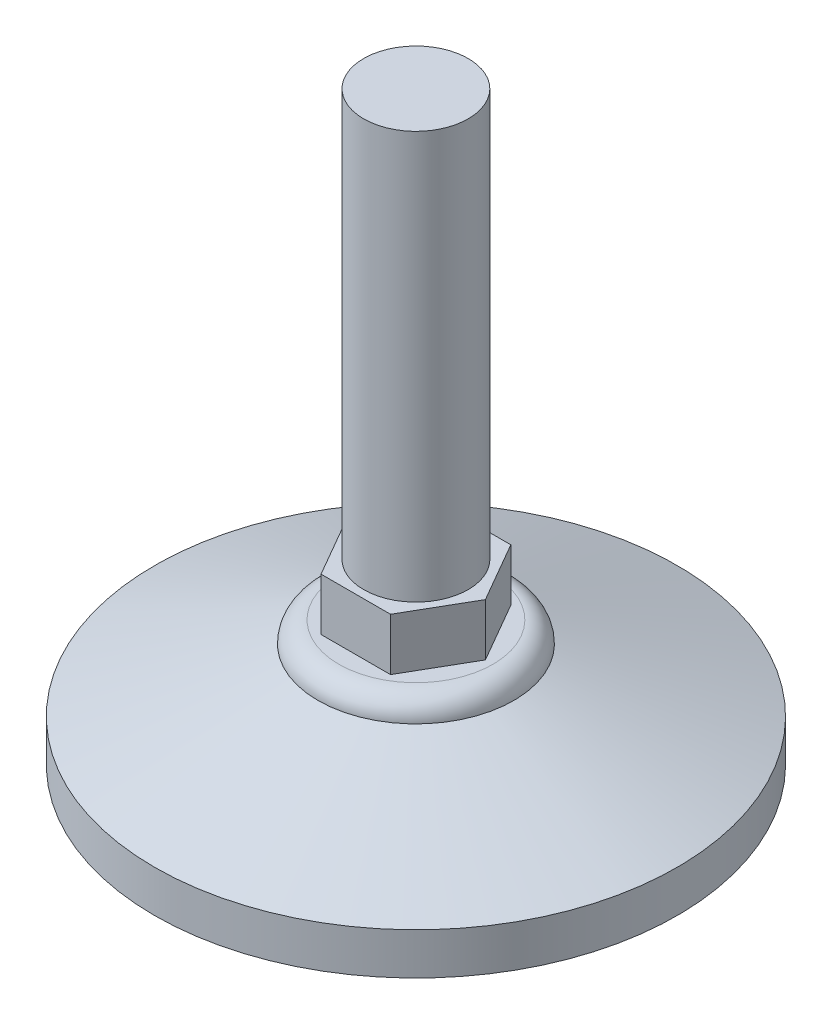
from build123d import *

# Parameters (mm, degrees)
SKETCH2_R           = 25
BOSS_EXTRUDE1_DEPTH = 4
SKETCH4_R           = 25
BOSS_EXTRUDE2_DEPTH = 6
BOSS_EXTRUDE2_TAPER = 69
SKETCH5_R           = 9.369465612
BOSS_EXTRUDE3_DEPTH = 2
SKETCH6_R           = 5
BOSS_EXTRUDE4_DEPTH = 44
FILLET1_R           = 2
BOSS_EXTRUDE5_DEPTH = 5


with BuildPart() as part:
    # Sketch2 → Boss-Extrude1 (new body)
    with BuildSketch(Plane(origin=(0, 0, 0), x_dir=(1, 0, 0), z_dir=(0, 1, 0))):
        with Locations(Location((0, 0, 0), (0, 0, 270))):
            Circle(SKETCH2_R)
    extrude(amount=BOSS_EXTRUDE1_DEPTH)

    # Sketch4 → Boss-Extrude2 (add)
    with BuildSketch(Plane(origin=(0, 4, 0), x_dir=(1, 0, 0), z_dir=(0, 1, 0))):
        with Locations(Location((0, 0, 0), (0, 0, 270))):
            Circle(SKETCH4_R)
    extrude(amount=BOSS_EXTRUDE2_DEPTH, taper=BOSS_EXTRUDE2_TAPER)

    # Sketch5 → Boss-Extrude3 (add)
    with BuildSketch(Plane(origin=(0, 10, 0), x_dir=(1, 0, 0), z_dir=(0, 1, 0))):
        with Locations(Location((0, 0, 0), (0, 0, 270))):
            Circle(SKETCH5_R)
    extrude(amount=BOSS_EXTRUDE3_DEPTH)

    # Sketch6 → Boss-Extrude4 (add)
    with BuildSketch(Plane(origin=(0, 12, 0), x_dir=(1, 0, 0), z_dir=(0, 1, 0))):
        with Locations(Location((0, 0, 0), (0, 0, 270))):
            Circle(SKETCH6_R)
    extrude(amount=BOSS_EXTRUDE4_DEPTH)

    # Fillet1
    fillet1_edges = [part.edges().sort_by_distance(p)[0] for p in [
        (0, 12, -9.369465612),
    ]]
    fillet(fillet1_edges, radius=FILLET1_R - 0.0001)  # a hair under: the kernel refuses the full size

    # Sketch7 → Boss-Extrude5 (add)
    with BuildSketch(Plane(origin=(0, 12, 0), x_dir=(1, 0, 0), z_dir=(0, 1, 0))):
        Polygon((6.645053271, 0), (3.322526636, 5.754784943), (-3.322526636, 5.754784943), (-6.645053271, 0), (-3.322526636, -5.754784943), (3.322526636, -5.754784943), align=None)
    extrude(amount=BOSS_EXTRUDE5_DEPTH)


solid = part.part
